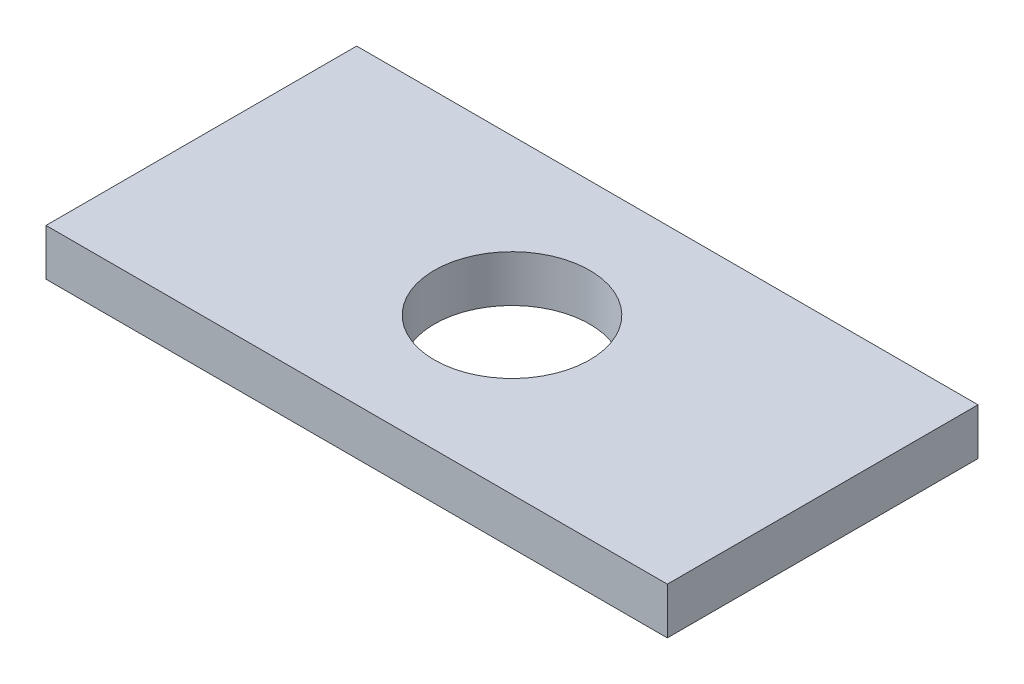
from build123d import *

# Parameters (mm, degrees)
CROQUIS1_W            = 40
CROQUIS1_H            = 20
BRIDA_BASE1_DEPTH     = 3
CROQUIS5_R            = 5
CORTAR_EXTRUIR1_DEPTH = 23.561028345


# Sheet-metal steps are written as plain solids
with BuildPart() as part:
    # Croquis1 → Brida base1 (new body)
    with BuildSketch(Plane(origin=(0, 0, 0), x_dir=(1, 0, 0), z_dir=(0, 1, 0))):
        Rectangle(CROQUIS1_W, CROQUIS1_H)
    extrude(amount=-BRIDA_BASE1_DEPTH)

    # Croquis5 → Cortar-Extruir1 (cut, through all)
    with BuildSketch(Plane(origin=(0, 0, 0), x_dir=(1, 0, 0), z_dir=(0, 1, 0))):
        with Locations(Location((0, 0, 0), (0, 0, 270))):
            Circle(CROQUIS5_R)
    extrude(amount=-CORTAR_EXTRUIR1_DEPTH, mode=Mode.SUBTRACT)


solid = part.part
